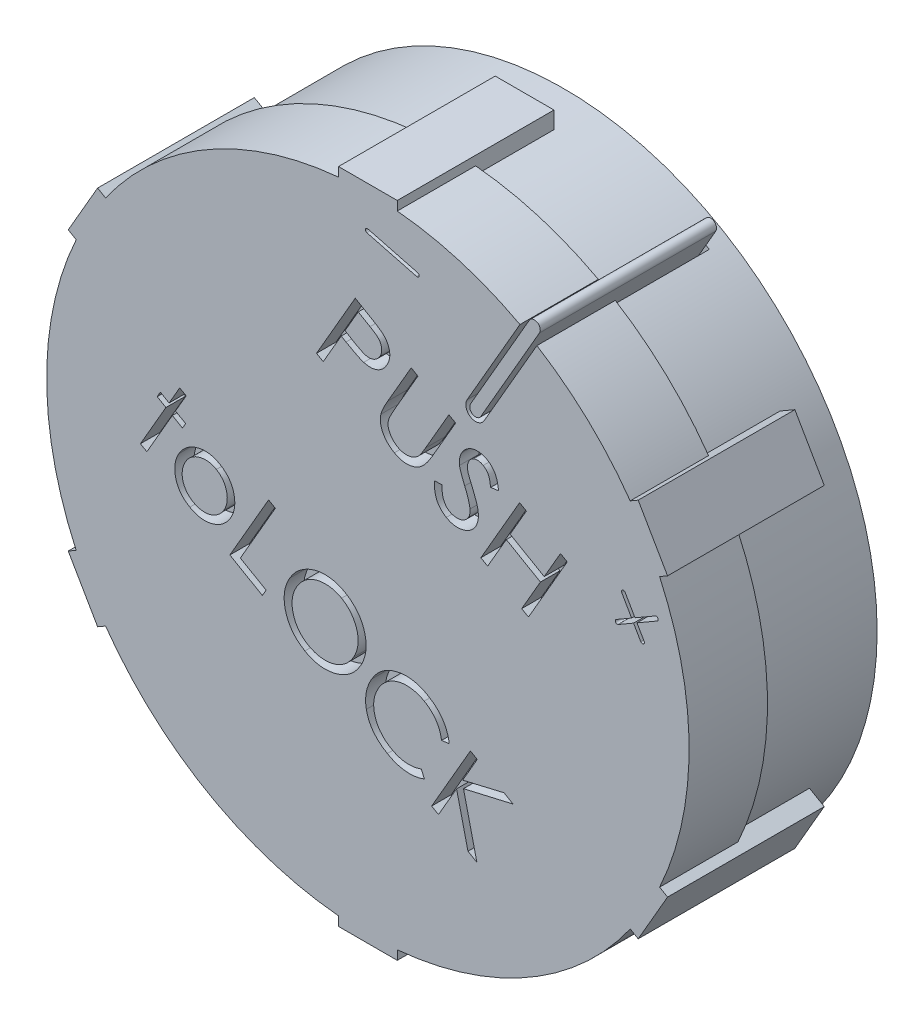
from build123d import *

# Parameters (mm, degrees)
SKETCH1_R           = 8
BOSS_EXTRUDE1_DEPTH = 5
BOSS_EXTRUDE2_DEPTH = 4
BOSS_EXTRUDE3_DEPTH = 2
CUT_EXTRUDE1_DEPTH  = 4.5
BOSS_EXTRUDE5_DEPTH = 4.5
WRAP2_START         = -0.5
WRAP2_DEPTH         = 0.5


# Read off the part's stored shape, not the designer's step: Wrap2
with BuildPart() as part:
    # Sketch1 → Boss-Extrude1 (new body)
    with BuildSketch(Plane.XY):
        Circle(SKETCH1_R)
    extrude(amount=-BOSS_EXTRUDE1_DEPTH)

    # Sketch1<3> → Boss-Extrude2 (add)
    with BuildSketch(Plane.XY):
        with BuildLine():
            ThreePointArc((-7.446642313, 3.43329554), (-7.101408311, 4.1), (-6.696642313, 4.732333646))
            Line((-6.696642313, 4.732333646), (-6.899613392, 4.849519053))
            Line((-6.899613392, 4.849519053), (-7.649613392, 3.550480947))
            Line((-7.649613392, 3.550480947), (-7.446642313, 3.43329554))
        make_face()
        with BuildLine():
            Line((-6.522689831, 4.631902133), (-6.696642313, 4.732333646))
            ThreePointArc((-6.696642313, 4.732333646), (-7.101408311, 4.1), (-7.446642313, 3.43329554))
            Line((-7.446642313, 3.43329554), (-7.272689831, 3.332864028))
            ThreePointArc((-7.272689831, 3.332864028), (-6.92820323, 4), (-6.522689831, 4.631902133))
        make_face()
        with BuildLine():
            Line((-7.272689831, -3.332864028), (-7.446642313, -3.43329554))
            ThreePointArc((-7.446642313, -3.43329554), (-7.101408311, -4.1), (-6.696642313, -4.732333646))
            Line((-6.696642313, -4.732333646), (-6.522689831, -4.631902133))
            ThreePointArc((-6.522689831, -4.631902133), (-6.92820323, -4), (-7.272689831, -3.332864028))
        make_face()
        with BuildLine():
            ThreePointArc((-6.696642313, -4.732333646), (-7.101408311, -4.1), (-7.446642313, -3.43329554))
            Line((-7.446642313, -3.43329554), (-7.649613392, -3.550480947))
            Line((-7.649613392, -3.550480947), (-6.899613392, -4.849519053))
            Line((-6.899613392, -4.849519053), (-6.696642313, -4.732333646))
        make_face()
        with BuildLine():
            Line((0.75, -8.4), (0.75, -8.165629186))
            ThreePointArc((0.75, -8.165629186), (0, -8.2), (-0.75, -8.165629186))
            Line((-0.75, -8.165629186), (-0.75, -8.4))
            Line((-0.75, -8.4), (0.75, -8.4))
        make_face()
        with BuildLine():
            ThreePointArc((-0.75, -8.165629186), (0, -8.2), (0.75, -8.165629186))
            Line((0.75, -8.165629186), (0.75, -7.964766161))
            ThreePointArc((0.75, -7.964766161), (0, -8), (-0.75, -7.964766161))
            Line((-0.75, -7.964766161), (-0.75, -8.165629186))
        make_face()
        with BuildLine():
            Line((7.649613392, -3.550480947), (7.446642313, -3.43329554))
            ThreePointArc((7.446642313, -3.43329554), (7.101408311, -4.1), (6.696642313, -4.732333646))
            Line((6.696642313, -4.732333646), (6.899613392, -4.849519053))
            Line((6.899613392, -4.849519053), (7.649613392, -3.550480947))
        make_face()
        with BuildLine():
            ThreePointArc((6.696642313, -4.732333646), (7.101408311, -4.1), (7.446642313, -3.43329554))
            Line((7.446642313, -3.43329554), (7.272689831, -3.332864028))
            ThreePointArc((7.272689831, -3.332864028), (6.92820323, -4), (6.522689831, -4.631902133))
            Line((6.522689831, -4.631902133), (6.696642313, -4.732333646))
        make_face()
        with BuildLine():
            Line((7.649613392, 3.550480947), (6.899613392, 4.849519053))
            Line((6.899613392, 4.849519053), (6.696642313, 4.732333646))
            ThreePointArc((6.696642313, 4.732333646), (7.101408311, 4.1), (7.446642313, 3.43329554))
            Line((7.446642313, 3.43329554), (7.649613392, 3.550480947))
        make_face()
        with BuildLine():
            ThreePointArc((7.446642313, 3.43329554), (7.101408311, 4.1), (6.696642313, 4.732333646))
            Line((6.696642313, 4.732333646), (6.522689831, 4.631902133))
            ThreePointArc((6.522689831, 4.631902133), (6.92820323, 4), (7.272689831, 3.332864028))
            Line((7.272689831, 3.332864028), (7.446642313, 3.43329554))
        make_face()
        with BuildLine():
            ThreePointArc((-0.75, 8.165629186), (0, 8.2), (0.75, 8.165629186))
            Line((0.75, 8.165629186), (0.75, 8.4))
            Line((0.75, 8.4), (-0.75, 8.4))
            Line((-0.75, 8.4), (-0.75, 8.165629186))
        make_face()
        with BuildLine():
            Line((0.75, 7.964766161), (0.75, 8.165629186))
            ThreePointArc((0.75, 8.165629186), (0, 8.2), (-0.75, 8.165629186))
            Line((-0.75, 8.165629186), (-0.75, 7.964766161))
            ThreePointArc((-0.75, 7.964766161), (0, 8), (0.75, 7.964766161))
        make_face()
    extrude(amount=-BOSS_EXTRUDE2_DEPTH)

    # Sketch1<4> → Boss-Extrude3 (add)
    with BuildSketch(Plane.XY):
        with BuildLine():
            Line((6.522689831, 4.631902133), (6.696642313, 4.732333646))
            ThreePointArc((6.696642313, 4.732333646), (4.1, 7.101408311), (0.75, 8.165629186))
            Line((0.75, 8.165629186), (0.75, 7.964766161))
            ThreePointArc((0.75, 7.964766161), (4, 6.92820323), (6.522689831, 4.631902133))
        make_face()
        with BuildLine():
            Line((-0.75, 7.964766161), (-0.75, 8.165629186))
            ThreePointArc((-0.75, 8.165629186), (-4.1, 7.101408311), (-6.696642313, 4.732333646))
            Line((-6.696642313, 4.732333646), (-6.522689831, 4.631902133))
            ThreePointArc((-6.522689831, 4.631902133), (-4, 6.92820323), (-0.75, 7.964766161))
        make_face()
        with BuildLine():
            ThreePointArc((8.2, 0), (8.009446515, 1.757488696), (7.446642313, 3.43329554))
            Line((7.446642313, 3.43329554), (7.272689831, 3.332864028))
            ThreePointArc((7.272689831, 3.332864028), (7.816057787, 1.705649635), (8, 0))
            ThreePointArc((8, 0), (7.816057787, -1.705649635), (7.272689831, -3.332864028))
            Line((7.272689831, -3.332864028), (7.446642313, -3.43329554))
            ThreePointArc((7.446642313, -3.43329554), (8.009446515, -1.757488696), (8.2, 0))
        make_face()
        with BuildLine():
            ThreePointArc((0.75, -8.165629186), (4.1, -7.101408311), (6.696642313, -4.732333646))
            Line((6.696642313, -4.732333646), (6.522689831, -4.631902133))
            ThreePointArc((6.522689831, -4.631902133), (4, -6.92820323), (0.75, -7.964766161))
            Line((0.75, -7.964766161), (0.75, -8.165629186))
        make_face()
        with BuildLine():
            ThreePointArc((-6.696642313, -4.732333646), (-4.1, -7.101408311), (-0.75, -8.165629186))
            Line((-0.75, -8.165629186), (-0.75, -7.964766161))
            ThreePointArc((-0.75, -7.964766161), (-4, -6.92820323), (-6.522689831, -4.631902133))
            Line((-6.522689831, -4.631902133), (-6.696642313, -4.732333646))
        make_face()
        with BuildLine():
            Line((-7.272689831, 3.332864028), (-7.446642313, 3.43329554))
            ThreePointArc((-7.446642313, 3.43329554), (-8.2, 0), (-7.446642313, -3.43329554))
            Line((-7.446642313, -3.43329554), (-7.272689831, -3.332864028))
            ThreePointArc((-7.272689831, -3.332864028), (-8, 0), (-7.272689831, 3.332864028))
        make_face()
    extrude(amount=-BOSS_EXTRUDE3_DEPTH)

    # Sketch2 → Cut-Extrude1 (cut)
    with BuildSketch(Plane.XY):
        with BuildLine():
            Line((4.466506351, 7.236215932), (2.966506351, 4.638139721))
            ThreePointArc((2.966506351, 4.638139721), (2.625, 4.54663337), (2.533493649, 4.888139721))
            Line((2.533493649, 4.888139721), (4.033493649, 7.486215932))
            ThreePointArc((4.033493649, 7.486215932), (4.375, 7.577722283), (4.466506351, 7.236215932))
        make_face()
        with BuildLine():
            Line((4.379903811, 7.286215932), (2.879903811, 4.688139721))
            ThreePointArc((2.879903811, 4.688139721), (2.675, 4.63323591), (2.620096189, 4.838139721))
            Line((2.620096189, 4.838139721), (4.120096189, 7.436215932))
            ThreePointArc((4.120096189, 7.436215932), (4.325, 7.491119743), (4.379903811, 7.286215932))
        make_face(mode=Mode.SUBTRACT)
    extrude(amount=-CUT_EXTRUDE1_DEPTH, mode=Mode.SUBTRACT)

    # Sketch2<2> → Boss-Extrude5 (add)
    with BuildSketch(Plane.XY):
        with BuildLine():
            ThreePointArc((3.969410156, 7.175220067), (4.1, 7.101408311), (4.229217778, 7.025220067))
            Line((4.229217778, 7.025220067), (4.379903811, 7.286215932))
            ThreePointArc((4.379903811, 7.286215932), (4.325, 7.491119743), (4.120096189, 7.436215932))
            Line((4.120096189, 7.436215932), (3.969410156, 7.175220067))
        make_face()
        with BuildLine():
            Line((2.879903811, 4.688139721), (4.229217778, 7.025220067))
            ThreePointArc((4.229217778, 7.025220067), (4.1, 7.101408311), (3.969410156, 7.175220067))
            Line((3.969410156, 7.175220067), (2.620096189, 4.838139721))
            ThreePointArc((2.620096189, 4.838139721), (2.675, 4.63323591), (2.879903811, 4.688139721))
        make_face()
    extrude(amount=-BOSS_EXTRUDE5_DEPTH)

    # Wrap2 outline → Wrap2 (cut)
    # profile 1 of 12: a face of its own
    with BuildSketch(Plane.XY.offset(WRAP2_START)):
        with BuildLine():
            add(Edge.make_bspline(
                [(0.018477672, 5.505391779), (0.041896845, 5.49185207), (0.086790206, 5.465897139), (0.150391839, 5.427385903), (0.20772668, 5.39178404), (0.258731001, 5.358970743), (0.303297188, 5.328788122), (0.340956845, 5.300477642), (0.372843721, 5.27562444), (0.391157935, 5.258963024), (0.399487287, 5.251385369)],
                knots=[0, 0, 0, 0, 0.176911533, 0.339130393, 0.486239768, 0.618272707, 0.735766243, 0.838128728, 0.926380524, 1, 1, 1, 1], degree=3))
            Line((0.018477672, 5.505391779), (-0.322868482, 5.702507164))
            Line((-0.322868482, 5.702507164), (-1.312051174, 3.989766779))
            Line((-1.312051174, 3.989766779), (-1.140576816, 3.890808446))
            Line((-1.140576816, 3.890808446), (-0.680640918, 4.687282805))
            Line((-0.680640918, 4.687282805), (-0.558445405, 4.616769984))
            add(Edge.make_bspline(
                [(-0.106522328, 4.393212292), (-0.118597743, 4.397063741), (-0.14506774, 4.405506337), (-0.186752099, 4.422849983), (-0.234849597, 4.443488765), (-0.288065428, 4.469903542), (-0.347684963, 4.499854377), (-0.412747552, 4.534815493), (-0.483759461, 4.574152151), (-0.532836207, 4.602156679), (-0.558445405, 4.616769984)],
                knots=[0, 0, 0, 0, 0.075260065, 0.164974356, 0.267997905, 0.386147951, 0.517773002, 0.664348835, 0.824850714, 1, 1, 1, 1], degree=3))
            add(Edge.make_bspline(
                [(0.483621902, 4.628388574), (0.47525907, 4.614647004), (0.458838894, 4.587665834), (0.43154861, 4.550010412), (0.402673268, 4.515679266), (0.371753186, 4.485016916), (0.338722265, 4.458349721), (0.304596156, 4.434282083), (0.268312758, 4.414203963), (0.230290308, 4.397825188), (0.190922383, 4.385126397), (0.150781906, 4.3753415), (0.109871571, 4.36937656), (0.068052331, 4.366960816), (0.025422372, 4.36815852), (-0.018053327, 4.373216048), (-0.062321943, 4.381001276), (-0.091621859, 4.389095815), (-0.106522328, 4.393212292)],
                knots=[0, 0, 0, 0, 0.069716904, 0.136887101, 0.201381572, 0.264019849, 0.325327546, 0.385233186, 0.444841526, 0.504747166, 0.564434181, 0.623975002, 0.683664825, 0.743399558, 0.805373411, 0.868286682, 0.933017203, 1, 1, 1, 1], degree=3))
            add(Edge.make_bspline(
                [(0.399487287, 5.251385369), (0.409686014, 5.241272155), (0.429858548, 5.221268762), (0.456590973, 5.188650545), (0.480416386, 5.154765377), (0.50141352, 5.119507237), (0.51889166, 5.082496136), (0.533873759, 5.044419958), (0.545569716, 5.004881945), (0.553832419, 4.96412035), (0.559242329, 4.922620655), (0.560404958, 4.880751126), (0.557583329, 4.83889946), (0.550707051, 4.796915461), (0.539623015, 4.7548096), (0.525492973, 4.712246361), (0.506259959, 4.670018421), (0.491270947, 4.642454647), (0.483621902, 4.628388574)],
                knots=[0, 0, 0, 0, 0.063173463, 0.124953711, 0.185282832, 0.245356629, 0.305292273, 0.365210625, 0.425275798, 0.486480288, 0.548078561, 0.609226589, 0.670487489, 0.732421297, 0.796139182, 0.861932031, 0.929542519, 1, 1, 1, 1], degree=3))
        make_face()
        with BuildLine():
            add(Edge.make_bspline(
                [(-0.296025533, 4.684478318), (-0.281786957, 4.676372219), (-0.254309495, 4.660729151), (-0.213705784, 4.639591128), (-0.175767152, 4.620605653), (-0.140089918, 4.604548394), (-0.106844855, 4.591185249), (-0.075893409, 4.580810163), (-0.047492073, 4.572560644), (-0.012971313, 4.565573728), (0.028365316, 4.562766923), (0.076771938, 4.56614716), (0.123536713, 4.577579016), (0.168260152, 4.596104238), (0.20965148, 4.621383862), (0.247359069, 4.652012714), (0.280413717, 4.688405604), (0.297742773, 4.716362045), (0.306538569, 4.730552035)],
                knots=[0, 0, 0, 0, 0.071293891, 0.137582231, 0.199180103, 0.255887509, 0.30779685, 0.355028695, 0.397897152, 0.4364209, 0.508095141, 0.577451133, 0.646802255, 0.71663144, 0.787297221, 0.85709738, 0.927466204, 1, 1, 1, 1], degree=3))
            Line((-0.296025533, 4.684478318), (-0.58368579, 4.854750753))
            Line((-0.58368579, 4.854750753), (-0.247547969, 5.437282805))
            Line((-0.247547969, 5.437282805), (0.054936005, 5.262603318))
            add(Edge.make_bspline(
                [(0.306538569, 4.730552035), (0.314041051, 4.744920481), (0.328962559, 4.773497539), (0.343666458, 4.819331573), (0.351463021, 4.866731522), (0.351962956, 4.914726205), (0.346850297, 4.962346628), (0.333735627, 5.007554221), (0.314322392, 5.049945361), (0.292193134, 5.082651914), (0.270595289, 5.108148366), (0.250109931, 5.127691053), (0.226707519, 5.148595099), (0.199059667, 5.169648898), (0.168471255, 5.192220576), (0.133654412, 5.214827714), (0.095859369, 5.239050846), (0.06889388, 5.254570193), (0.054936005, 5.262603318)],
                knots=[0, 0, 0, 0, 0.072293233, 0.143782289, 0.213894494, 0.286076913, 0.35754606, 0.427023637, 0.49534455, 0.564990905, 0.60264402, 0.644401002, 0.691310048, 0.742734398, 0.799524239, 0.861064535, 0.928084229, 1, 1, 1, 1], degree=3))
        make_face(mode=Mode.SUBTRACT)
    # profile 2 of 12: a face of its own
    with BuildSketch(Plane.XY.offset(WRAP2_START)):
        with BuildLine():
            add(Edge.make_bspline(
                [(0.679230898, 3.744975112), (0.670794698, 3.730431724), (0.654736846, 3.70274917), (0.632223023, 3.663125422), (0.612812009, 3.627405666), (0.595391984, 3.596405226), (0.581314425, 3.569306452), (0.56990632, 3.546505153), (0.560232868, 3.528270087), (0.555759506, 3.517044144), (0.553830257, 3.512202677)],
                knots=[0, 0, 0, 0, 0.190672958, 0.362935662, 0.516806528, 0.651700703, 0.766184649, 0.863042789, 0.940933794, 1, 1, 1, 1], degree=3))
            Line((0.679230898, 3.744975112), (1.276586668, 4.7790296))
            Line((1.276586668, 4.7790296), (1.10551295, 4.877987933))
            Line((1.10551295, 4.877987933), (0.50815718, 3.843933446))
            add(Edge.make_bspline(
                [(0.331073847, 3.464927035), (0.333733089, 3.475519302), (0.339519761, 3.498568718), (0.352180236, 3.534779396), (0.36885862, 3.575451238), (0.389343647, 3.620536706), (0.413476579, 3.670184224), (0.441044443, 3.72447125), (0.473290946, 3.782733642), (0.496226817, 3.822992386), (0.50815718, 3.843933446)],
                knots=[0, 0, 0, 0, 0.078060841, 0.16986513, 0.273958906, 0.392349425, 0.523896842, 0.668677882, 0.827658897, 1, 1, 1, 1], degree=3))
            add(Edge.make_bspline(
                [(0.67602577, 2.784237933), (0.659220114, 2.794475005), (0.626211431, 2.814582062), (0.57940696, 2.847329188), (0.537086905, 2.883006267), (0.497322345, 2.919541986), (0.46234924, 2.959242327), (0.429754551, 2.999941442), (0.401993002, 3.043441771), (0.377278138, 3.088272305), (0.357196072, 3.134544891), (0.340491785, 3.181036564), (0.328462292, 3.227869136), (0.320414698, 3.274899551), (0.316288724, 3.322214261), (0.316759247, 3.369822478), (0.321485647, 3.41756851), (0.327865292, 3.449079179), (0.331073847, 3.464927035)],
                knots=[0, 0, 0, 0, 0.072067508, 0.141550766, 0.208936459, 0.274683261, 0.339106759, 0.402512113, 0.465463051, 0.527843231, 0.589823263, 0.650001506, 0.708606728, 0.766664408, 0.824588008, 0.882306796, 0.940807827, 1, 1, 1, 1], degree=3))
            add(Edge.make_bspline(
                [(1.641971283, 3.18928601), (1.631153714, 3.17064286), (1.610090239, 3.134341773), (1.577007986, 3.082490507), (1.544172181, 3.034302595), (1.512331935, 2.988938573), (1.479599139, 2.94791789), (1.447949965, 2.909604785), (1.415566565, 2.875634889), (1.383890625, 2.844321175), (1.351070298, 2.816128219), (1.31610338, 2.79137304), (1.279066447, 2.769132435), (1.239732473, 2.749996944), (1.198357984, 2.733497293), (1.154774341, 2.719971669), (1.109223335, 2.708581708), (1.061652047, 2.700813151), (1.013225299, 2.695709616), (0.964405295, 2.695388796), (0.915852805, 2.699336719), (0.867527852, 2.707988001), (0.81923052, 2.720347309), (0.771040267, 2.737361384), (0.722936482, 2.758508645), (0.691797952, 2.775587308), (0.67602577, 2.784237933)],
                knots=[0, 0, 0, 0, 0.054233293, 0.105600587, 0.154720235, 0.200973206, 0.245007287, 0.286743821, 0.325969643, 0.363041905, 0.398799259, 0.434700024, 0.470720123, 0.507391162, 0.544645747, 0.582695147, 0.622143457, 0.662694254, 0.703890191, 0.74455362, 0.785354287, 0.826293113, 0.867942972, 0.910667593, 0.954751655, 1, 1, 1, 1], degree=3))
            Line((1.641971283, 3.18928601), (2.239327052, 4.223340497))
            Line((2.239327052, 4.223340497), (2.068253334, 4.321898189))
            Line((2.068253334, 4.321898189), (1.470897565, 3.287843702))
            add(Edge.make_bspline(
                [(1.299423206, 3.030231523), (1.304458477, 3.035491992), (1.315613061, 3.047145453), (1.331697157, 3.068303011), (1.35021647, 3.093705112), (1.37101856, 3.12339697), (1.392815873, 3.158277504), (1.417462207, 3.197059722), (1.443878552, 3.240679471), (1.461617617, 3.271644679), (1.470897565, 3.287843702)],
                knots=[0, 0, 0, 0, 0.070411286, 0.155981374, 0.256782984, 0.374715512, 0.506629811, 0.654700651, 0.819361395, 1, 1, 1, 1], degree=3))
            add(Edge.make_bspline(
                [(0.760561027, 2.952907805), (0.774973364, 2.945259493), (0.803547863, 2.930095633), (0.848931165, 2.912725337), (0.895986301, 2.900696971), (0.944366888, 2.893963002), (0.992984776, 2.892336316), (1.040959771, 2.895900842), (1.087721395, 2.904791779), (1.133371216, 2.918828224), (1.177511757, 2.938662352), (1.220291328, 2.963671218), (1.261357671, 2.994252279), (1.286566965, 3.018079904), (1.299423206, 3.030231523)],
                knots=[0, 0, 0, 0, 0.083303452, 0.165160882, 0.247573783, 0.330944271, 0.414230956, 0.495657862, 0.576216817, 0.656931655, 0.739095625, 0.822883873, 0.909674275, 1, 1, 1, 1], degree=3))
            add(Edge.make_bspline(
                [(0.553830257, 3.512202677), (0.546867954, 3.494446052), (0.533420011, 3.460148482), (0.520648605, 3.407905567), (0.513850477, 3.357506338), (0.514177341, 3.308122438), (0.52180117, 3.259129703), (0.538206407, 3.210012152), (0.561488453, 3.159958498), (0.592111326, 3.110177904), (0.628345496, 3.063023297), (0.668444426, 3.020131555), (0.712478385, 2.983132118), (0.744553974, 2.962969693), (0.760561027, 2.952907805)],
                knots=[0, 0, 0, 0, 0.087153987, 0.168341118, 0.245319592, 0.319234251, 0.393448665, 0.471105185, 0.555279855, 0.645480245, 0.737845042, 0.826860767, 0.913596325, 1, 1, 1, 1], degree=3))
        make_face()
    # profile 3 of 12: a face of its own
    with BuildSketch(Plane.XY.offset(WRAP2_START)):
        with BuildLine():
            add(Edge.make_bspline(
                [(1.890456633, 2.682875753), (1.890188485, 2.653212003), (1.889675279, 2.596438876), (1.89738547, 2.515159701), (1.911082731, 2.441790884), (1.931241254, 2.376166406), (1.958627735, 2.318395239), (1.992791608, 2.268596269), (2.033786334, 2.226507318), (2.06590765, 2.205430126), (2.081963044, 2.194894984)],
                knots=[0, 0, 0, 0, 0.16157591, 0.309238362, 0.444123177, 0.567729671, 0.682314404, 0.791128119, 0.895598294, 1, 1, 1, 1], degree=3))
            Line((1.890456633, 2.682875753), (1.694142531, 2.679670625))
            add(Edge.make_bspline(
                [(2.00223548, 2.018612933), (1.989589692, 2.026345457), (1.964453069, 2.041715756), (1.928661546, 2.067187507), (1.89598754, 2.095643789), (1.864719987, 2.125013156), (1.836908888, 2.157311309), (1.810964134, 2.191210249), (1.787333413, 2.227118892), (1.766349641, 2.265591427), (1.747868973, 2.30652167), (1.732104762, 2.350575054), (1.71957434, 2.397821509), (1.709130054, 2.448108221), (1.701096912, 2.501461368), (1.695989146, 2.558045781), (1.693641844, 2.617818153), (1.693972796, 2.658702361), (1.694142531, 2.679670625)],
                knots=[0, 0, 0, 0, 0.057717612, 0.114727989, 0.170798393, 0.226338093, 0.281621539, 0.336541758, 0.392508357, 0.448831434, 0.507022733, 0.56722886, 0.630812799, 0.697212023, 0.767158068, 0.840797948, 0.918350123, 1, 1, 1, 1], degree=3))
            add(Edge.make_bspline(
                [(2.753838044, 2.199302035), (2.744696257, 2.184242867), (2.726572034, 2.154387028), (2.693653118, 2.114112953), (2.658081681, 2.077197602), (2.61826325, 2.045085743), (2.575489629, 2.016511148), (2.528850634, 1.992272675), (2.478711592, 1.972433071), (2.425801652, 1.956449536), (2.371350628, 1.945356886), (2.316776091, 1.93916086), (2.262655731, 1.938728112), (2.209247382, 1.944032833), (2.156393536, 1.95455137), (2.104039258, 1.970262886), (2.052217455, 1.991450895), (2.019039475, 2.009481026), (2.00223548, 2.018612933)],
                knots=[0, 0, 0, 0, 0.061491135, 0.121910416, 0.181311853, 0.24034921, 0.300276269, 0.360808987, 0.423636757, 0.488450558, 0.55370639, 0.61755878, 0.680094698, 0.742457992, 0.804784607, 0.86812332, 0.933207051, 1, 1, 1, 1], degree=3))
            add(Edge.make_bspline(
                [(2.683725864, 2.972939856), (2.693862948, 2.949219231), (2.713521773, 2.903217874), (2.740093136, 2.835567236), (2.762423226, 2.771475006), (2.781555784, 2.71115802), (2.796675689, 2.654453197), (2.808697609, 2.601333345), (2.816235655, 2.551782519), (2.820473176, 2.505474975), (2.821080513, 2.461845252), (2.819709558, 2.419946463), (2.815168222, 2.379549074), (2.808530189, 2.340534051), (2.798833261, 2.303025717), (2.786373715, 2.267051866), (2.771580613, 2.232322998), (2.759749192, 2.210303362), (2.753838044, 2.199302035)],
                knots=[0, 0, 0, 0, 0.095914468, 0.186006719, 0.270183143, 0.348238893, 0.421232463, 0.48834245, 0.550635313, 0.607461255, 0.66109962, 0.712780707, 0.763230483, 0.812131558, 0.859825202, 0.907093001, 0.95358233, 1, 1, 1, 1], degree=3))
            add(Edge.make_bspline(
                [(2.56112971, 3.271818061), (2.562832967, 3.266465173), (2.566906213, 3.253664031), (2.575018778, 3.231598164), (2.586445857, 3.203551912), (2.600438473, 3.169272831), (2.616736869, 3.128645164), (2.636433374, 3.082192146), (2.659502196, 3.029790549), (2.675353478, 2.992589067), (2.683725864, 2.972939856)],
                knots=[0, 0, 0, 0, 0.052147486, 0.124707898, 0.218183117, 0.333302454, 0.468451888, 0.624579591, 0.801709116, 1, 1, 1, 1], degree=3))
            add(Edge.make_bspline(
                [(2.581562403, 3.55667383), (2.576529243, 3.547296649), (2.566493597, 3.528599431), (2.555408359, 3.498503475), (2.546906845, 3.467293386), (2.541597426, 3.43427588), (2.539919434, 3.398647738), (2.54314081, 3.359750431), (2.550043543, 3.316900662), (2.557299051, 3.287395678), (2.56112971, 3.271818061)],
                knots=[0, 0, 0, 0, 0.108555634, 0.21644973, 0.326603857, 0.438474992, 0.557239947, 0.689860297, 0.836256894, 1, 1, 1, 1], degree=3))
            add(Edge.make_bspline(
                [(2.942539967, 3.638805241), (2.925602231, 3.647766116), (2.892846514, 3.665095464), (2.840154989, 3.67927399), (2.787684033, 3.682667357), (2.736697712, 3.675273039), (2.688582509, 3.659074037), (2.645994736, 3.633381752), (2.608926412, 3.599409536), (2.590846596, 3.571173407), (2.581562403, 3.55667383)],
                knots=[0, 0, 0, 0, 0.138584902, 0.268007942, 0.39218875, 0.517347198, 0.639218917, 0.757783966, 0.87561928, 1, 1, 1, 1], degree=3))
            add(Edge.make_bspline(
                [(3.134447018, 3.248580882), (3.132536861, 3.263284685), (3.128830526, 3.291814905), (3.121959583, 3.332798788), (3.114818406, 3.370782075), (3.106939777, 3.405434207), (3.098168955, 3.436881148), (3.088484588, 3.464896252), (3.078667687, 3.48993644), (3.064252393, 3.518625324), (3.043559767, 3.55064367), (3.01473527, 3.585146094), (2.980633319, 3.614618172), (2.955308131, 3.630698197), (2.942539967, 3.638805241)],
                knots=[0, 0, 0, 0, 0.098124702, 0.190394229, 0.274986878, 0.353888658, 0.425519731, 0.490925584, 0.550012328, 0.60337452, 0.703161032, 0.801619547, 0.899982803, 1, 1, 1, 1], degree=3))
            Line((3.134447018, 3.248580882), (3.335568813, 3.273821266))
            add(Edge.make_bspline(
                [(3.047908557, 3.81428601), (3.067553603, 3.802169488), (3.106481262, 3.778159984), (3.157394198, 3.732209349), (3.202776575, 3.681118193), (3.235151832, 3.633105214), (3.257368478, 3.590601194), (3.272885783, 3.555223152), (3.287567142, 3.516723376), (3.299596071, 3.474508629), (3.310901911, 3.42909165), (3.320859907, 3.380316798), (3.329304309, 3.328191124), (3.333443149, 3.292269977), (3.335568813, 3.273821266)],
                knots=[0, 0, 0, 0, 0.108246623, 0.214496189, 0.320745755, 0.428817652, 0.485512304, 0.545909018, 0.610241939, 0.678937351, 0.751985349, 0.830126984, 0.912755065, 1, 1, 1, 1], degree=3))
            add(Edge.make_bspline(
                [(2.400472659, 3.652026394), (2.41160278, 3.670002979), (2.433462132, 3.705308657), (2.474410737, 3.751857535), (2.520225533, 3.792079081), (2.57081891, 3.825912609), (2.625461383, 3.852310532), (2.683164996, 3.871545812), (2.74381345, 3.881804262), (2.806135901, 3.88400157), (2.869014515, 3.87895223), (2.930851452, 3.865711815), (2.991027472, 3.844262241), (3.028763386, 3.824375481), (3.047908557, 3.81428601)],
                knots=[0, 0, 0, 0, 0.085098861, 0.167132582, 0.248760872, 0.330275494, 0.411647807, 0.492673982, 0.57462112, 0.658656107, 0.743456515, 0.82823471, 0.912855541, 1, 1, 1, 1], degree=3))
            add(Edge.make_bspline(
                [(2.339575223, 3.33792383), (2.338143308, 3.352199869), (2.335324457, 3.380303498), (2.335109391, 3.422232779), (2.33759136, 3.463157356), (2.344519018, 3.502926003), (2.352829704, 3.541991262), (2.365646017, 3.579786093), (2.381019557, 3.61678222), (2.393972729, 3.640250141), (2.400472659, 3.652026394)],
                knots=[0, 0, 0, 0, 0.132088509, 0.260027758, 0.385795962, 0.509158873, 0.631511807, 0.753269648, 0.876190176, 1, 1, 1, 1], degree=3))
            add(Edge.make_bspline(
                [(2.471386121, 2.949702677), (2.461848401, 2.97251636), (2.443596411, 3.016174088), (2.418395775, 3.078909459), (2.396448173, 3.135970257), (2.378657134, 3.187529884), (2.363546238, 3.233094369), (2.352302146, 3.27307898), (2.343840266, 3.307218898), (2.340896108, 3.328414507), (2.339575223, 3.33792383)],
                knots=[0, 0, 0, 0, 0.180506547, 0.345428899, 0.49353665, 0.626730911, 0.743576601, 0.843877612, 0.929956332, 1, 1, 1, 1], degree=3))
            add(Edge.make_bspline(
                [(2.606001505, 2.50579242), (2.604430946, 2.519837788), (2.601139658, 2.549271492), (2.592518425, 2.595165356), (2.580121229, 2.644725423), (2.565704493, 2.69855563), (2.546260855, 2.755697035), (2.524883568, 2.817194521), (2.499538613, 2.882308567), (2.480964635, 2.926772719), (2.471386121, 2.949702677)],
                knots=[0, 0, 0, 0, 0.091057934, 0.190822496, 0.300621648, 0.420263986, 0.549813542, 0.689453379, 0.839852548, 1, 1, 1, 1], degree=3))
            add(Edge.make_bspline(
                [(2.567139326, 2.303068061), (2.574818701, 2.31778664), (2.590330976, 2.347518047), (2.6027755, 2.39737324), (2.609304453, 2.450489974), (2.607126958, 2.48694856), (2.606001505, 2.50579242)],
                knots=[0, 0, 0, 0, 0.236823802, 0.478382104, 0.730398364, 1, 1, 1, 1], degree=3))
            add(Edge.make_bspline(
                [(2.081963044, 2.194894984), (2.096473355, 2.187156299), (2.125126692, 2.17187481), (2.171187155, 2.155885418), (2.218530425, 2.145458504), (2.26680385, 2.140665799), (2.314657825, 2.141573178), (2.360667862, 2.149452172), (2.404385206, 2.162454705), (2.444822027, 2.182057274), (2.482261922, 2.205823026), (2.514940449, 2.234614516), (2.544356192, 2.266401344), (2.559499041, 2.29077194), (2.567139326, 2.303068061)],
                knots=[0, 0, 0, 0, 0.089172378, 0.176087616, 0.263698706, 0.351863119, 0.438899249, 0.522697918, 0.604579992, 0.685662001, 0.765909771, 0.844556129, 0.921571197, 1, 1, 1, 1], degree=3))
        make_face()
    # profile 4 of 12: a face of its own
    with BuildSketch(Plane.XY.offset(WRAP2_START)):
        with BuildLine():
            add(Edge.make_bspline(
                [(-3.415619232, -0.187717195), (-3.410994949, -0.21195527), (-3.401848517, -0.259896088), (-3.396698588, -0.332385251), (-3.397015507, -0.403895588), (-3.405503874, -0.474532585), (-3.419605968, -0.544257052), (-3.44136484, -0.612931513), (-3.469090538, -0.680869054), (-3.492908642, -0.724254748), (-3.504962181, -0.746210785)],
                knots=[0, 0, 0, 0, 0.127729257, 0.252637439, 0.375793602, 0.497654572, 0.62058511, 0.743782075, 0.87033675, 1, 1, 1, 1], degree=3))
            add(Edge.make_bspline(
                [(-3.777398078, 0.303869343), (-3.753807481, 0.28956126), (-3.70743916, 0.261438115), (-3.644975667, 0.211051149), (-3.588576991, 0.156858938), (-3.539634766, 0.097352943), (-3.497632102, 0.0331116), (-3.462526969, -0.035850228), (-3.434720842, -0.109825777), (-3.422042689, -0.161524001), (-3.415619232, -0.187717195)],
                knots=[0, 0, 0, 0, 0.131340336, 0.258155005, 0.381462778, 0.5035195, 0.624424475, 0.746517688, 0.871571773, 1, 1, 1, 1], degree=3))
            add(Edge.make_bspline(
                [(-4.385971796, 0.371577677), (-4.359931245, 0.379202376), (-4.308673266, 0.394210765), (-4.230306953, 0.407048906), (-4.152805966, 0.410895557), (-4.075918516, 0.407167659), (-3.999771938, 0.39401733), (-3.924312674, 0.372705569), (-3.849467517, 0.342928932), (-3.801727726, 0.317055321), (-3.777398078, 0.303869343)],
                knots=[0, 0, 0, 0, 0.128788889, 0.253506846, 0.376091908, 0.496776646, 0.618366458, 0.74226392, 0.868649867, 1, 1, 1, 1], degree=3))
            add(Edge.make_bspline(
                [(-4.824273078, 0.015808446), (-4.811332111, 0.037186963), (-4.785808037, 0.079352812), (-4.7407788, 0.137092843), (-4.692220418, 0.189857139), (-4.639588558, 0.237494084), (-4.58228304, 0.279337233), (-4.520748008, 0.315717565), (-4.455352556, 0.347456978), (-4.409256814, 0.36348248), (-4.385971796, 0.371577677)],
                knots=[0, 0, 0, 0, 0.129614982, 0.255645687, 0.379260884, 0.501474637, 0.623481808, 0.746879139, 0.872137346, 1, 1, 1, 1], degree=3))
            add(Edge.make_bspline(
                [(-4.546628847, -1.027861426), (-4.570035506, -1.01362123), (-4.615982952, -0.985667617), (-4.678495553, -0.936835964), (-4.73451041, -0.8841217), (-4.783037343, -0.826552036), (-4.824988955, -0.764955898), (-4.860186874, -0.699068696), (-4.888267877, -0.628798414), (-4.908667826, -0.554939326), (-4.922706287, -0.479869443), (-4.929525417, -0.405149462), (-4.929561203, -0.331662322), (-4.922935557, -0.259424378), (-4.908610645, -0.188361963), (-4.887735719, -0.118623648), (-4.860186437, -0.049864549), (-4.836347512, -0.006271478), (-4.824273078, 0.015808446)],
                knots=[0, 0, 0, 0, 0.068221472, 0.133919262, 0.197237793, 0.259573694, 0.321136483, 0.382620975, 0.445342066, 0.509290561, 0.573253774, 0.635407321, 0.695971794, 0.756137273, 0.81585197, 0.876284654, 0.937338083, 1, 1, 1, 1], degree=3))
            add(Edge.make_bspline(
                [(-3.504962181, -0.746210785), (-3.518016523, -0.767739014), (-3.543810906, -0.810277146), (-3.589711786, -0.868390282), (-3.639336838, -0.921609474), (-3.69388746, -0.969191567), (-3.752895254, -1.011373465), (-3.81670654, -1.047982609), (-3.884954621, -1.079248208), (-3.956932616, -1.104664522), (-4.031027169, -1.123643004), (-4.105825518, -1.134468024), (-4.180396577, -1.137544123), (-4.254628331, -1.131532126), (-4.328715514, -1.118512104), (-4.402392152, -1.096528764), (-4.475600992, -1.066395719), (-4.522674707, -1.040857114), (-4.546628847, -1.027861426)],
                knots=[0, 0, 0, 0, 0.062734353, 0.12395828, 0.184275082, 0.243990312, 0.304154289, 0.364878873, 0.427171424, 0.491109766, 0.555002989, 0.617598395, 0.679255592, 0.740712781, 0.802970601, 0.866515676, 0.932074572, 1, 1, 1, 1], degree=3))
        make_face()
        with BuildLine():
            add(Edge.make_bspline(
                [(-4.659609617, -0.08395117), (-4.671851192, -0.107037338), (-4.696038297, -0.152651366), (-4.721285257, -0.225811974), (-4.736997261, -0.301195272), (-4.743043969, -0.378232693), (-4.738926368, -0.454669984), (-4.725970561, -0.528908037), (-4.70230713, -0.599613663), (-4.669537291, -0.666516898), (-4.627863684, -0.728172387), (-4.578263587, -0.783597505), (-4.521751877, -0.833152619), (-4.478929326, -0.859764021), (-4.457285899, -0.87321399)],
                knots=[0, 0, 0, 0, 0.086259671, 0.170433271, 0.254746779, 0.340189535, 0.425048886, 0.507123748, 0.588496577, 0.670612967, 0.752633217, 0.83360284, 0.915899336, 1, 1, 1, 1], degree=3))
            add(Edge.make_bspline(
                [(-3.869545514, 0.144414215), (-3.886453546, 0.153621788), (-3.919756794, 0.171757669), (-3.972399826, 0.191878629), (-4.025357668, 0.207516482), (-4.079541398, 0.216782854), (-4.134750912, 0.219845634), (-4.190853376, 0.217449535), (-4.247836231, 0.209213046), (-4.304862012, 0.195799579), (-4.360592284, 0.177010177), (-4.413849823, 0.153833416), (-4.463579401, 0.125669217), (-4.510066909, 0.093141678), (-4.552625636, 0.055511757), (-4.592114248, 0.013600082), (-4.628393793, -0.032852429), (-4.649115812, -0.066773337), (-4.659609617, -0.08395117)],
                knots=[0, 0, 0, 0, 0.063136488, 0.12435806, 0.184577814, 0.244183236, 0.30434711, 0.365780228, 0.428214165, 0.49308041, 0.557823574, 0.62103308, 0.68345932, 0.745126636, 0.806948036, 0.86959556, 0.933962095, 1, 1, 1, 1], degree=3))
            add(Edge.make_bspline(
                [(-3.672430129, -0.654063349), (-3.662714695, -0.636347409), (-3.643631374, -0.601549277), (-3.621654156, -0.546917861), (-3.605034755, -0.491821671), (-3.594196705, -0.435975307), (-3.588967172, -0.379480905), (-3.58928046, -0.32228415), (-3.595913516, -0.26448036), (-3.607841964, -0.206676521), (-3.625039381, -0.150479597), (-3.645953837, -0.096805276), (-3.672316968, -0.047268996), (-3.702853549, -0.001320165), (-3.737900826, 0.040992745), (-3.777444661, 0.07954795), (-3.821109602, 0.114824328), (-3.85328171, 0.134478527), (-3.869545514, 0.144414215)],
                knots=[0, 0, 0, 0, 0.066296916, 0.130222202, 0.192932645, 0.255026754, 0.316684205, 0.378956135, 0.442492171, 0.507424804, 0.572487616, 0.635271613, 0.69627846, 0.756361028, 0.816158059, 0.876317394, 0.937475357, 1, 1, 1, 1], degree=3))
            add(Edge.make_bspline(
                [(-4.457285899, -0.87321399), (-4.43471978, -0.885152832), (-4.390102719, -0.908757957), (-4.319055123, -0.933611242), (-4.246147391, -0.948592113), (-4.171923106, -0.953759095), (-4.097563867, -0.949252439), (-4.02465493, -0.933453703), (-3.953517906, -0.908772919), (-3.885837098, -0.873017596), (-3.821723097, -0.830065178), (-3.764882391, -0.778057077), (-3.713554552, -0.720127097), (-3.686252483, -0.676268074), (-3.672430129, -0.654063349)],
                knots=[0, 0, 0, 0, 0.084266341, 0.166608918, 0.247699268, 0.329536591, 0.411784521, 0.49296487, 0.575307448, 0.659779201, 0.745210234, 0.829571265, 0.913716201, 1, 1, 1, 1], degree=3))
        make_face(mode=Mode.SUBTRACT)
    # profile 5 of 12: a face of its own
    with BuildSketch(Plane.XY.offset(WRAP2_START)):
        with BuildLine():
            add(Edge.make_bspline(
                [(1.879456712, -2.972973606), (1.876819638, -2.955717654), (1.871582569, -2.921448384), (1.8608428, -2.870957521), (1.846990036, -2.821971563), (1.831205112, -2.774021913), (1.811770244, -2.727766572), (1.790277029, -2.682661115), (1.765565789, -2.639380736), (1.72988415, -2.5830969), (1.678425401, -2.516957896), (1.607785052, -2.44407801), (1.5273628, -2.378823751), (1.468028555, -2.342133737), (1.437950302, -2.323534503)],
                knots=[0, 0, 0, 0, 0.06427298, 0.127642223, 0.189924038, 0.251661811, 0.313397626, 0.37454303, 0.435539939, 0.496792037, 0.61984479, 0.743301729, 0.869872187, 1, 1, 1, 1], degree=3))
            Line((1.879456712, -2.972973606), (2.074568892, -2.94733258))
            add(Edge.make_bspline(
                [(1.532902225, -2.153262067), (1.552552509, -2.164908587), (1.591456568, -2.187966619), (1.646481884, -2.226324464), (1.698953735, -2.265886057), (1.747903956, -2.308065322), (1.793593792, -2.352551807), (1.836101111, -2.399239623), (1.875929259, -2.447514387), (1.91187667, -2.498187774), (1.944760465, -2.55014901), (1.974128853, -2.603512733), (1.999566183, -2.658124345), (2.022515924, -2.713504243), (2.040499111, -2.77049363), (2.056120437, -2.828254332), (2.067226521, -2.88737043), (2.072112319, -2.927270755), (2.074568892, -2.94733258)],
                knots=[0, 0, 0, 0, 0.068555928, 0.135728516, 0.201243761, 0.265780042, 0.329574761, 0.39257711, 0.455259707, 0.517341889, 0.578966661, 0.639795902, 0.700059624, 0.759771316, 0.819617464, 0.879329157, 0.939326877, 1, 1, 1, 1], degree=3))
            add(Edge.make_bspline(
                [(0.095001584, -2.509431939), (0.113524732, -2.479131512), (0.149977701, -2.41950123), (0.213862034, -2.337804444), (0.283781599, -2.264522753), (0.359727255, -2.199735047), (0.441746486, -2.143544277), (0.530013925, -2.096074571), (0.624483756, -2.057331272), (0.723710787, -2.027035708), (0.825794301, -2.006163811), (0.928604028, -1.995854618), (1.031034295, -1.995111521), (1.132914188, -2.005831664), (1.234271296, -2.0266887), (1.335001238, -2.058500017), (1.435561518, -2.099870833), (1.50009453, -2.135267095), (1.532902225, -2.153262067)],
                knots=[0, 0, 0, 0, 0.06435828, 0.126655062, 0.187632593, 0.247758766, 0.307340143, 0.367584712, 0.429152807, 0.492200089, 0.555462351, 0.617777488, 0.679289833, 0.740882214, 0.803195468, 0.866616983, 0.932189911, 1, 1, 1, 1], degree=3))
            add(Edge.make_bspline(
                [(-0.040014442, -3.245008862), (-0.045184082, -3.213697424), (-0.055455014, -3.151488524), (-0.05966571, -3.05738928), (-0.056515911, -2.964013537), (-0.043252046, -2.871384735), (-0.021982141, -2.779422958), (0.007749311, -2.688011898), (0.046820149, -2.597495703), (0.078766658, -2.539105374), (0.095001584, -2.509431939)],
                knots=[0, 0, 0, 0, 0.124438063, 0.247230899, 0.368905907, 0.490602356, 0.613785986, 0.738910767, 0.86731682, 1, 1, 1, 1], degree=3))
            add(Edge.make_bspline(
                [(0.496443892, -3.953742836), (0.478046257, -3.942822025), (0.441841625, -3.921331003), (0.389818707, -3.886585467), (0.340733503, -3.850364594), (0.294600666, -3.81236942), (0.250554478, -3.773826229), (0.21033754, -3.732586273), (0.172145433, -3.690796135), (0.137002628, -3.647238843), (0.105143105, -3.60198723), (0.075683371, -3.555409538), (0.049336213, -3.507309936), (0.025534562, -3.457877677), (0.004730524, -3.406884522), (-0.013435854, -3.354385292), (-0.028122742, -3.300218523), (-0.036036851, -3.263475643), (-0.040014442, -3.245008862)],
                knots=[0, 0, 0, 0, 0.06987075, 0.137498374, 0.204238145, 0.269026447, 0.332672553, 0.395286389, 0.45705121, 0.517544544, 0.577937144, 0.637721782, 0.697460255, 0.756965766, 0.816826736, 0.877246111, 0.93830453, 1, 1, 1, 1], degree=3))
            add(Edge.make_bspline(
                [(1.44115543, -4.044287708), (1.422530025, -4.051301772), (1.385477845, -4.065255099), (1.3287879, -4.082519519), (1.271516925, -4.096163085), (1.21355418, -4.106096391), (1.154990546, -4.113078591), (1.095709559, -4.116085098), (1.035788525, -4.116220307), (0.975449413, -4.112576996), (0.914852722, -4.105341714), (0.854376118, -4.094547774), (0.794074455, -4.079999898), (0.733981059, -4.062047428), (0.674218327, -4.040124884), (0.614361221, -4.015504878), (0.554955282, -3.98648557), (0.516108198, -3.964746901), (0.496443892, -3.953742836)],
                knots=[0, 0, 0, 0, 0.060704381, 0.12076138, 0.180645394, 0.240190292, 0.300074306, 0.3604593, 0.421163681, 0.482792061, 0.544746815, 0.607241737, 0.67008891, 0.733891495, 0.798459542, 0.864209571, 0.931263192, 1, 1, 1, 1], degree=3))
            Line((1.44115543, -4.044287708), (1.365434276, -3.863598606))
            add(Edge.make_bspline(
                [(0.600209917, -3.797893477), (0.630069692, -3.814054951), (0.688917966, -3.845906325), (0.781752423, -3.881563889), (0.875974302, -3.906176894), (0.971537455, -3.919920397), (1.068444266, -3.922682703), (1.166770713, -3.914487044), (1.266634795, -3.895359143), (1.332104018, -3.874313104), (1.365434276, -3.863598606)],
                knots=[0, 0, 0, 0, 0.128209009, 0.252677023, 0.374723015, 0.495560872, 0.616739734, 0.740298869, 0.867786646, 1, 1, 1, 1], degree=3))
            add(Edge.make_bspline(
                [(0.266475943, -2.628422323), (0.252347937, -2.654348908), (0.224541109, -2.705377773), (0.19215325, -2.785030516), (0.168238969, -2.865275214), (0.152941833, -2.946228101), (0.145950805, -3.027864727), (0.148181378, -3.11017392), (0.158608101, -3.193146142), (0.177854504, -3.275911364), (0.20491207, -3.356634196), (0.239038496, -3.433830263), (0.280792519, -3.506348591), (0.330717169, -3.573760162), (0.386760061, -3.637627244), (0.45110292, -3.696008756), (0.522009197, -3.750632741), (0.573840131, -3.781956853), (0.600209917, -3.797893477)],
                knots=[0, 0, 0, 0, 0.065077055, 0.128085061, 0.189218234, 0.249467365, 0.309466168, 0.369568259, 0.430722713, 0.493594961, 0.55664976, 0.618224067, 0.679452239, 0.740777383, 0.802953141, 0.866531305, 0.932095746, 1, 1, 1, 1], degree=3))
            add(Edge.make_bspline(
                [(1.437950302, -2.323534503), (1.420843174, -2.314082304), (1.38688705, -2.295320532), (1.334108351, -2.271518938), (1.280931283, -2.250374343), (1.226504542, -2.233579521), (1.171353072, -2.220413468), (1.115292965, -2.210690871), (1.058540737, -2.204744339), (1.001272702, -2.202357651), (0.944390974, -2.203464356), (0.888358032, -2.208454536), (0.833566657, -2.216225033), (0.779919228, -2.228030087), (0.727523357, -2.243110209), (0.676312277, -2.262165873), (0.626411752, -2.284548627), (0.577717462, -2.310190139), (0.531070342, -2.339369219), (0.486488389, -2.371629559), (0.443682011, -2.406400379), (0.403793485, -2.445002896), (0.366059025, -2.486458199), (0.330229837, -2.530558687), (0.29685851, -2.578010599), (0.276693605, -2.611468853), (0.266475943, -2.628422323)],
                knots=[0, 0, 0, 0, 0.043409343, 0.086163679, 0.128537398, 0.170489291, 0.212592023, 0.254447263, 0.296816826, 0.33928602, 0.381727216, 0.423125586, 0.464207981, 0.50459983, 0.54507334, 0.585255383, 0.625898221, 0.666515054, 0.70743532, 0.748034808, 0.788725277, 0.829858006, 0.871235102, 0.913220562, 0.956028407, 1, 1, 1, 1], degree=3))
        make_face()
    # profile 6 of 12: a face of its own
    with BuildSketch(Plane.XY.offset(WRAP2_START)):
        with BuildLine():
            add(Edge.make_bspline(
                [(-0.189857723, -2.35758899), (-0.208399126, -2.387876249), (-0.244943132, -2.447570637), (-0.308705233, -2.529605949), (-0.378612996, -2.603309917), (-0.454837034, -2.668559), (-0.536879972, -2.72576209), (-0.62520311, -2.774567815), (-0.719866241, -2.814480275), (-0.819169667, -2.846373943), (-0.921022784, -2.868615038), (-1.022950396, -2.88119328), (-1.123786726, -2.883960829), (-1.22351968, -2.875191711), (-1.32204801, -2.856748886), (-1.419468737, -2.828035137), (-1.515875179, -2.789268875), (-1.577323138, -2.755663873), (-1.608527595, -2.738598606)],
                knots=[0, 0, 0, 0, 0.065082693, 0.128274123, 0.190115261, 0.251077304, 0.311948276, 0.373222863, 0.435767968, 0.500050933, 0.564227449, 0.626650173, 0.688137279, 0.748845462, 0.809894019, 0.871657522, 0.934825219, 1, 1, 1, 1], degree=3))
            add(Edge.make_bspline(
                [(-0.58328721, -0.931306939), (-0.551917691, -0.950496938), (-0.490314344, -0.988182188), (-0.405959085, -1.053647784), (-0.329982196, -1.124427619), (-0.262754014, -1.201365702), (-0.203937201, -1.284026308), (-0.154440011, -1.372967352), (-0.113544499, -1.467497378), (-0.081343986, -1.566620806), (-0.058489256, -1.668153192), (-0.0461116, -1.769882834), (-0.043287978, -1.87071034), (-0.052095326, -1.970568406), (-0.070406535, -2.069566696), (-0.099646277, -2.167338434), (-0.138876042, -2.264230537), (-0.172668945, -2.326112631), (-0.189857723, -2.35758899)],
                knots=[0, 0, 0, 0, 0.066782143, 0.131146531, 0.19364284, 0.255213508, 0.316487901, 0.377655033, 0.439824909, 0.503368807, 0.566779103, 0.628636059, 0.689323267, 0.749723031, 0.810456802, 0.871961914, 0.934873361, 1, 1, 1, 1], degree=3))
            add(Edge.make_bspline(
                [(-1.997950671, -1.323935144), (-1.985764433, -1.303754714), (-1.961586181, -1.263715492), (-1.921469193, -1.20669588), (-1.877848575, -1.153253784), (-1.831589366, -1.102629031), (-1.781619597, -1.055853455), (-1.729195348, -1.011841815), (-1.673117655, -0.971995819), (-1.614972266, -0.934563391), (-1.554315545, -0.901659904), (-1.492441958, -0.872585274), (-1.429393999, -0.848079648), (-1.365256619, -0.828108962), (-1.300138685, -0.812206046), (-1.233784346, -0.801666371), (-1.166510441, -0.794700312), (-1.098516455, -0.792367229), (-1.030532133, -0.794334767), (-0.96320877, -0.80073178), (-0.896934132, -0.811512899), (-0.831967381, -0.826926779), (-0.767837045, -0.846001821), (-0.705131206, -0.870337956), (-0.64308038, -0.898115103), (-0.603303571, -0.92019564), (-0.58328721, -0.931306939)],
                knots=[0, 0, 0, 0, 0.043287888, 0.085885849, 0.127907256, 0.169913628, 0.211728379, 0.253526581, 0.295525076, 0.337982289, 0.380459334, 0.422155226, 0.463467016, 0.504581751, 0.545450673, 0.586458459, 0.627874235, 0.669596088, 0.711310011, 0.752701813, 0.793709599, 0.834521811, 0.875258041, 0.916481638, 0.957972151, 1, 1, 1, 1], degree=3))
            add(Edge.make_bspline(
                [(-1.608527595, -2.738598606), (-1.6392115, -2.719784958), (-1.699538859, -2.682795608), (-1.782543132, -2.618562913), (-1.857038605, -2.548246316), (-1.922971811, -2.47177972), (-1.980843885, -2.389531513), (-2.029652732, -2.301014292), (-2.070460362, -2.206604031), (-2.101948447, -2.107204227), (-2.12484271, -2.00562329), (-2.137365182, -1.90402475), (-2.139847448, -1.803776592), (-2.132331143, -1.704663265), (-2.114133688, -1.606930015), (-2.085708795, -1.510674848), (-2.047853755, -1.415385042), (-2.014758783, -1.354736849), (-1.997950671, -1.323935144)],
                knots=[0, 0, 0, 0, 0.066045625, 0.12985173, 0.192292516, 0.253834269, 0.314919575, 0.376601844, 0.439094122, 0.503455152, 0.567762447, 0.630017609, 0.691089135, 0.751586993, 0.812182658, 0.873246308, 0.93562496, 1, 1, 1, 1], degree=3))
        make_face()
        with BuildLine():
            add(Edge.make_bspline(
                [(-1.819665415, -1.426899888), (-1.833572831, -1.452275527), (-1.860853471, -1.502052115), (-1.891828216, -1.580362076), (-1.916093106, -1.6588578), (-1.930625698, -1.73874288), (-1.937899576, -1.819260876), (-1.935301481, -1.900584232), (-1.926072454, -1.982797895), (-1.907274499, -2.064600206), (-1.882128016, -2.1446627), (-1.849569865, -2.220588702), (-1.810620597, -2.291517793), (-1.765011935, -2.357232776), (-1.713043157, -2.41800941), (-1.654679899, -2.474002775), (-1.589484659, -2.524806906), (-1.542049918, -2.55394359), (-1.517982723, -2.568726811)],
                knots=[0, 0, 0, 0, 0.065960799, 0.129388008, 0.191755416, 0.253129467, 0.314288339, 0.375855709, 0.438442298, 0.502755455, 0.567028903, 0.629682208, 0.690913902, 0.751346653, 0.811859236, 0.873061357, 0.935594522, 1, 1, 1, 1], degree=3))
            add(Edge.make_bspline(
                [(-0.672229518, -1.103983221), (-0.688148446, -1.095228529), (-0.719886584, -1.077773985), (-0.769269465, -1.055367503), (-0.819746473, -1.036523931), (-0.871443403, -1.021239108), (-0.924149355, -1.009222246), (-0.978224158, -1.000704966), (-1.033384019, -0.99612797), (-1.089305089, -0.994337188), (-1.145214451, -0.996562141), (-1.20042803, -1.001368552), (-1.254421093, -1.010935851), (-1.307384113, -1.023371687), (-1.359639202, -1.038743076), (-1.410447329, -1.058679577), (-1.460348057, -1.081429078), (-1.508746496, -1.107917875), (-1.555494186, -1.137601563), (-1.600568479, -1.169787564), (-1.642498282, -1.205861514), (-1.682880544, -1.243976513), (-1.721062027, -1.285108072), (-1.755983832, -1.329925961), (-1.789778502, -1.376728369), (-1.80962647, -1.41004739), (-1.819665415, -1.426899888)],
                knots=[0, 0, 0, 0, 0.041095033, 0.081932638, 0.122568519, 0.162914635, 0.203818144, 0.244803048, 0.286659777, 0.32898075, 0.371311431, 0.413195418, 0.454278229, 0.495249765, 0.536261394, 0.577394181, 0.618632273, 0.660280156, 0.702111791, 0.743877893, 0.785469834, 0.827148399, 0.869488785, 0.912291371, 0.955637668, 1, 1, 1, 1], degree=3))
            add(Edge.make_bspline(
                [(-0.366941056, -2.255425529), (-0.357522226, -2.238438701), (-0.338888105, -2.204832125), (-0.314788794, -2.15308674), (-0.294807498, -2.100634304), (-0.277828554, -2.04802996), (-0.264984362, -1.994709837), (-0.255771334, -1.941036893), (-0.250136968, -1.886827893), (-0.248191216, -1.832358847), (-0.249607123, -1.77785489), (-0.255473075, -1.723828694), (-0.264157543, -1.670398574), (-0.276560002, -1.617588789), (-0.293235406, -1.565683715), (-0.312637099, -1.514076599), (-0.336695204, -1.463651749), (-0.363226285, -1.413710215), (-0.392999106, -1.365610182), (-0.425703538, -1.320107685), (-0.460651089, -1.277195901), (-0.497708625, -1.236495201), (-0.538001043, -1.199422094), (-0.580314126, -1.164652974), (-0.625000211, -1.132614134), (-0.656476189, -1.113533058), (-0.672229518, -1.103983221)],
                knots=[0, 0, 0, 0, 0.043944229, 0.086938837, 0.12903077, 0.170892085, 0.211938256, 0.253025568, 0.294041691, 0.335168994, 0.376286302, 0.417302425, 0.458041515, 0.4987234, 0.539917266, 0.581336647, 0.623381906, 0.666241419, 0.70926257, 0.751278495, 0.792953958, 0.834444937, 0.875714111, 0.916730235, 0.958324537, 1, 1, 1, 1], degree=3))
            add(Edge.make_bspline(
                [(-1.517982723, -2.568726811), (-1.501394758, -2.577876609), (-1.468321824, -2.596119395), (-1.417238444, -2.619677601), (-1.365190745, -2.639268321), (-1.312572732, -2.655942086), (-1.258989018, -2.668625281), (-1.204535348, -2.677973092), (-1.149382491, -2.683493824), (-1.093706459, -2.685556328), (-1.038198929, -2.683765533), (-0.98325278, -2.679341864), (-0.929417204, -2.670109827), (-0.876385477, -2.658473526), (-0.824741317, -2.642106326), (-0.774039018, -2.623009151), (-0.724583475, -2.599950628), (-0.676261894, -2.573610879), (-0.629548477, -2.544049328), (-0.584813686, -2.511587173), (-0.542923767, -2.475792808), (-0.502892968, -2.437553311), (-0.465314638, -2.39629647), (-0.430012099, -2.352121294), (-0.397014331, -2.305111617), (-0.377036682, -2.272105193), (-0.366941056, -2.255425529)],
                knots=[0, 0, 0, 0, 0.042699766, 0.085134409, 0.126680728, 0.168008289, 0.209486917, 0.250717856, 0.292479617, 0.33435626, 0.376223162, 0.417628514, 0.45851283, 0.499268347, 0.539931457, 0.58052652, 0.621342045, 0.662839244, 0.70451953, 0.745890935, 0.787332394, 0.828642404, 0.870626059, 0.913038267, 0.956054234, 1, 1, 1, 1], degree=3))
        make_face(mode=Mode.SUBTRACT)
    # profile 7 of 12: a face of its own
    with BuildSketch(Plane.XY.offset(WRAP2_START)):
        with BuildLine():
            Line((-0.025247139, 7.298351089), (1.245270148, 6.966842382))
            ThreePointArc((1.245270148, 6.966842382), (1.306273936, 7.00259903), (1.270517287, 7.063602818))
            Line((1.270517287, 7.063602818), (0, 7.395111525))
            ThreePointArc((0, 7.395111525), (-0.061003788, 7.359354877), (-0.025247139, 7.298351089))
        make_face()
    # profile 8 of 12: a face of its own
    with BuildSketch(Plane.XY.offset(WRAP2_START)):
        with BuildLine():
            Line((6.479693471, 2.595305876), (6.731930621, 2.158418317))
            Line((6.731930621, 2.158418317), (6.341256369, 1.932862433))
            ThreePointArc((6.341256369, 1.932862433), (6.322955099, 1.864561163), (6.391256369, 1.846259893))
            Line((6.391256369, 1.846259893), (6.781930621, 2.071815777))
            Line((6.781930621, 2.071815777), (6.965656337, 1.753593502))
            ThreePointArc((6.965656337, 1.753593502), (7.033957607, 1.735292231), (7.052258877, 1.803593502))
            Line((7.052258877, 1.803593502), (6.868533161, 2.121815777))
            Line((6.868533161, 2.121815777), (7.385487539, 2.420279526))
            ThreePointArc((7.385487539, 2.420279526), (7.403788809, 2.488580796), (7.335487539, 2.506882067))
            Line((7.335487539, 2.506882067), (6.818533161, 2.208418317))
            Line((6.818533161, 2.208418317), (6.566296011, 2.645305876))
            ThreePointArc((6.566296011, 2.645305876), (6.497994741, 2.663607146), (6.479693471, 2.595305876))
        make_face()
    # profile 9 of 12: a face of its own
    with BuildSketch(Plane.XY.offset(WRAP2_START)):
        Polygon((2.420504418, -3.579944759), (2.791498008, -2.937316554), (2.616818521, -2.836355016), (1.627635828, -4.5490954), (1.802315315, -4.650056939), (2.263853777, -3.851178734), (2.554719162, -5.084752452), (2.781481982, -5.215762067), (2.439735187, -3.759031298), (3.70656211, -3.465762067), (3.474991597, -3.331947965), align=None)
    # profile 10 of 12: a face of its own
    with BuildSketch(Plane.XY.offset(WRAP2_START)):
        Polygon((-4.911111282, 0.915247548), (-4.639476666, 1.385600112), (-4.803739487, 1.480151394), (-5.075374102, 1.00979883), (-5.297729871, 1.1384046), (-5.378258718, 0.998580882), (-5.155902948, 0.869975112), (-5.806944615, -0.257028093), (-5.642681794, -0.351579375), (-4.991640128, 0.77542383), (-4.733226666, 0.625984728), (-4.65269782, 0.765808446), align=None)
    # profile 11 of 12: a face of its own
    with BuildSketch(Plane.XY.offset(WRAP2_START)):
        Polygon((3.630434116, 2.462122548), (4.045498218, 3.180471907), (3.872821936, 3.280231523), (2.883639244, 1.567491138), (3.056315526, 1.467731523), (3.533478987, 2.294253959), (4.404071936, 1.791449471), (3.926908475, 0.964927035), (4.099584757, 0.86516742), (5.088767449, 2.577907805), (4.916091167, 2.67766742), (4.501027064, 1.959318061), align=None)
    # profile 12 of 12: a face of its own
    with BuildSketch(Plane.XY.offset(WRAP2_START)):
        Polygon((-3.256076189, -1.509031298), (-2.362646702, 0.038244343), (-2.534922343, 0.138003959), (-3.524105035, -1.574736426), (-2.69397683, -2.054303734), (-2.598223625, -1.88883899), align=None)
    extrude(amount=WRAP2_DEPTH, mode=Mode.SUBTRACT)


solid = part.part
